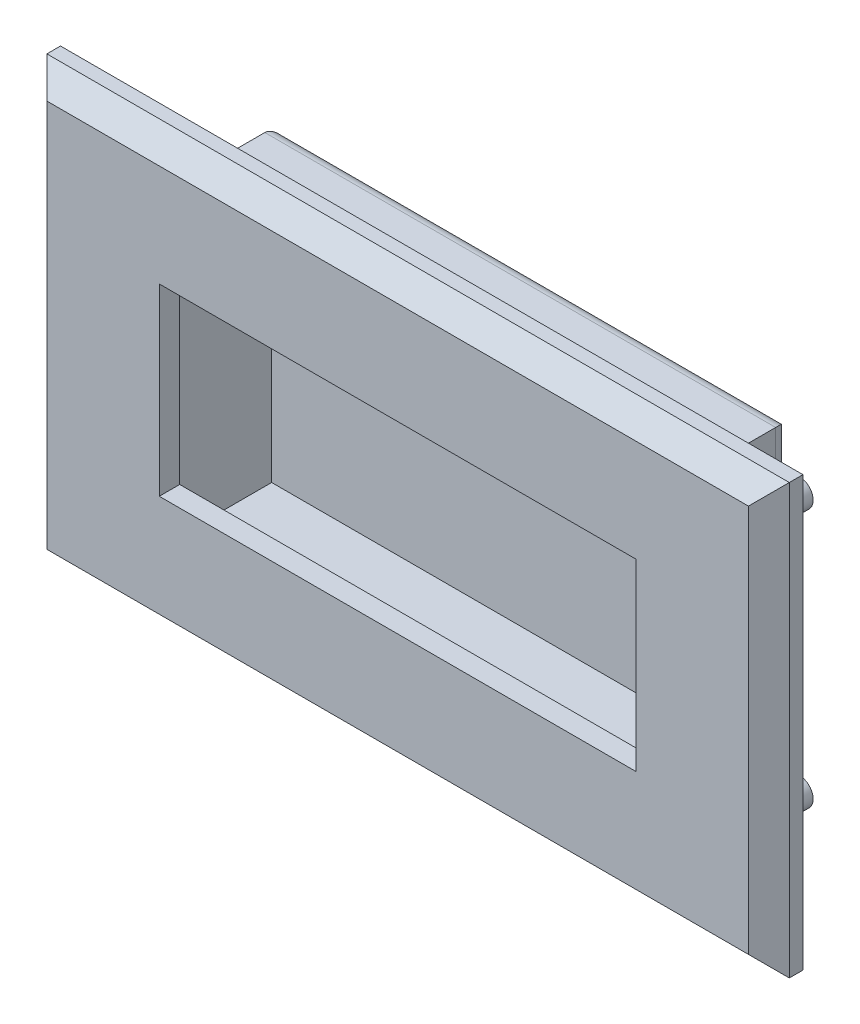
from build123d import *

# Parameters (mm, degrees)
SKETCH_1_W          = 109
SKETCH_1_H          = 63
EXTRUDE_1_DEPTH     = 5
CHAMFER_1_SIZE      = 3
SKETCH_2_W          = 75
SKETCH_2_H          = 45
EXTRUDE_2_DEPTH     = 20
SKETCH_3_W          = 70
SKETCH_3_H          = 27
CUT_EXTRUDE_1_DEPTH = 18
SKETCH_4_W          = 73
SKETCH_4_H          = 43
CUT_EXTRUDE_2_DEPTH = 15
SKETCH_5_R          = 2
EXTRUDE_3_DEPTH     = 10
FILLET_1_R          = 2


with BuildPart() as part:
    # 草图1 → 凸台-拉伸1 (new body)
    with BuildSketch(Plane.XY):
        Rectangle(SKETCH_1_W, SKETCH_1_H)
    extrude(amount=EXTRUDE_1_DEPTH)

    # 倒角1
    chamfer_1_edges = [part.edges().sort_by_distance(p)[0] for p in [
        (54.5, 0, 5),
        (0, -31.5, 5),
        (-54.5, 0, 5),
        (0, 31.5, 5),
    ]]
    chamfer(chamfer_1_edges, length=CHAMFER_1_SIZE)

    # 草图2 → 凸台-拉伸2 (add)
    with BuildSketch(Plane.XY.offset(5)):
        Rectangle(SKETCH_2_W, SKETCH_2_H)
    extrude(amount=-EXTRUDE_2_DEPTH)

    # 草图3 → 切除-拉伸1 (cut)
    with BuildSketch(Plane.XY.offset(5)):
        Rectangle(SKETCH_3_W, SKETCH_3_H)
    extrude(amount=-CUT_EXTRUDE_1_DEPTH, mode=Mode.SUBTRACT)

    # 草图4 → 切除-拉伸2 (cut)
    with BuildSketch(Plane.XY.offset(-13)):
        Rectangle(SKETCH_4_W, SKETCH_4_H)
    extrude(amount=CUT_EXTRUDE_2_DEPTH, mode=Mode.SUBTRACT)

    # 草图5 → 凸台-拉伸3 (add)
    with BuildSketch(Plane(origin=(0, 0, 0), x_dir=(-1, 0, 0), z_dir=(0, 0, -1))):
        with Locations((44, 19)):
            Circle(SKETCH_5_R)
        with Locations((44, -19)):
            Circle(SKETCH_5_R)
        with Locations((-44, -19)):
            Circle(SKETCH_5_R)
        with Locations((-44, 19)):
            Circle(SKETCH_5_R)
    extrude(amount=EXTRUDE_3_DEPTH)

    # 圆角1
    fillet_1_edges = [part.edges().sort_by_distance(p)[0] for p in [
        (37.5, 0, -15),
        (0, 22.5, -15),
        (-37.5, 0, -15),
        (0, -22.5, -15),
    ]]
    fillet(fillet_1_edges, radius=FILLET_1_R)


solid = part.part
